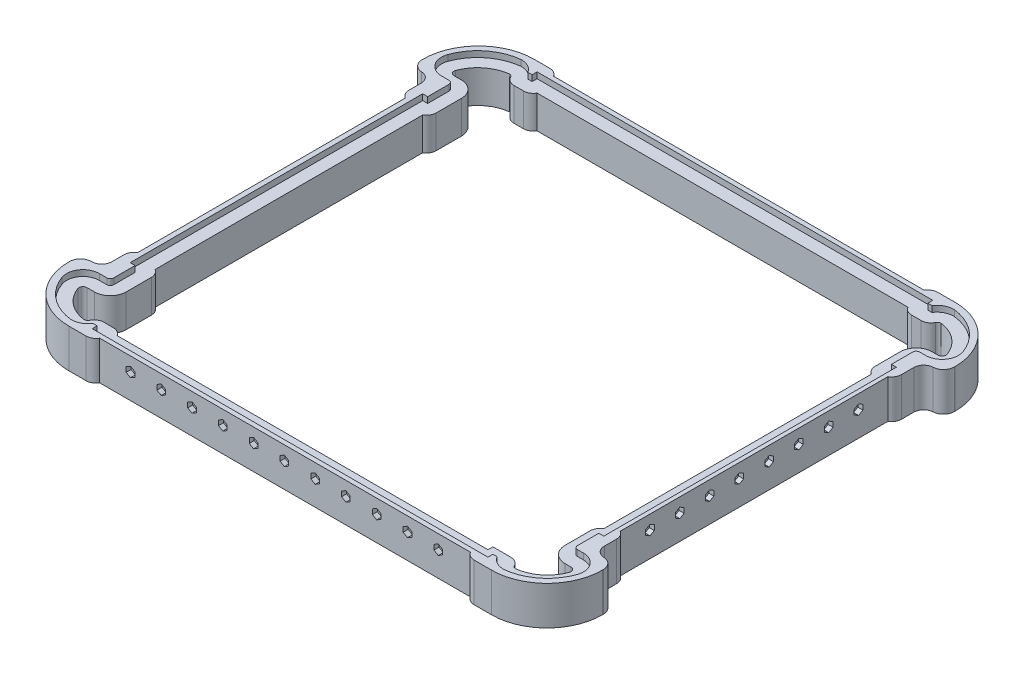
from build123d import *

# Parameters (mm, degrees)
BOSS_EXTRUDE1_DEPTH   = 30
BOSS_EXTRUDE1_2_DEPTH = 30
BOSS_EXTRUDE2_DEPTH   = 3
BOSS_EXTRUDE3_DEPTH   = 6
FILLET1_R             = 10
FILLET2_R             = 10
CUT_EXTRUDE1_DEPTH    = 5
CUT_EXTRUDE2_DEPTH    = 5
CUT_EXTRUDE4_DEPTH    = 5
CUT_EXTRUDE5_DEPTH    = 5


with BuildPart() as part:
    # Sketch1 → Boss-Extrude1 (new body)
    with BuildSketch(Plane(origin=(0, 0, 0), x_dir=(1, 0, 0), z_dir=(0, 1, 0))):
        with BuildLine():
            Line((-239.14494952, -138.470191502), (-244.137311203, -138.454972965))
            Line((-244.137311203, -138.454972965), (-244.184637086, -169.505062385))
            Line((-244.184637086, -169.505062385), (-254.644949535, -169.505062385))
            ThreePointArc((-254.644949535, -169.505062385), (-262.423124128, -172.726887792), (-265.644949535, -180.505062385))
            Line((-265.644949535, -180.505062385), (-265.644949535, -181.194423363))
            ThreePointArc((-265.644949535, -181.194423363), (-249.242929281, -220.792403109), (-209.644949535, -237.194423363))
            Line((-209.644949535, -237.194423363), (-183.644949535, -237.194423363))
            Line((-183.644949535, -237.194423363), (-183.644949535, -232.194423363))
            Line((-183.644949535, -232.194423363), (189.855050465, -232.194423363))
            Line((189.855050465, -232.194423363), (189.855050465, -237.194423363))
            Line((189.855050465, -237.194423363), (215.855050465, -237.194423363))
            ThreePointArc((215.855050465, -237.194423363), (255.408943073, -220.836441217), (271.854911786, -181.319051205))
            Line((271.854911786, -181.319051205), (271.855050146, -180.506936379))
            ThreePointArc((271.855050146, -180.506936379), (268.633887503, -172.727550438), (260.855050465, -169.505062385))
            Line((260.855050465, -169.505062385), (251.894737952, -169.505062385))
            Line((251.894737952, -169.505062385), (251.847412166, -138.454972965))
            Line((251.847412166, -138.454972965), (246.855050467, -138.470191471))
            Line((246.855050467, -138.470191471), (246.855050467, 131.081343169))
            Line((246.855050467, 131.081343169), (251.847411491, 131.066123323))
            Line((251.847411491, 131.066123323), (251.894741453, 162.11621566))
            Line((251.894741453, 162.11621566), (260.855050465, 162.11621566))
            ThreePointArc((260.855050465, 162.11621566), (268.633225058, 165.338041067), (271.855050465, 173.11621566))
            Line((271.855050465, 173.11621566), (271.855050465, 173.805576637))
            ThreePointArc((271.855050465, 173.805576637), (255.453030212, 213.403556384), (215.855050465, 229.805576637))
            Line((215.855050465, 229.805576637), (189.855050465, 229.805576637))
            Line((189.855050465, 229.805576637), (189.855050465, 224.805576637))
            Line((189.855050465, 224.805576637), (-183.644949535, 224.805576637))
            Line((-183.644949535, 224.805576637), (-183.644949535, 229.805576637))
            Line((-183.644949535, 229.805576637), (-208.144949535, 229.805576637))
            ThreePointArc((-208.144949535, 229.805576637), (-247.742929281, 213.403556384), (-264.144949535, 173.805576637))
            Line((-264.144949535, 173.805576637), (-264.144949535, 173.11621566))
            ThreePointArc((-264.144949535, 173.11621566), (-260.923124128, 165.338041067), (-253.144949535, 162.11621566))
            Line((-253.144949535, 162.11621566), (-244.184637078, 162.11621566))
            Line((-244.184637078, 162.11621566), (-244.137311203, 131.066123321))
            Line((-244.137311203, 131.066123321), (-239.14494952, 131.081343138))
            Line((-239.14494952, 131.081343138), (-239.14494952, -138.470191502))
        make_face()
        with BuildLine():
            Line((-188.644949535, 219.805576637), (194.855050465, 219.805576637))
            Line((194.855050465, 219.805576637), (194.855050465, 224.805576637))
            Line((194.855050465, 224.805576637), (215.855050465, 224.805576637))
            ThreePointArc((215.855050465, 224.805576637), (251.917496306, 209.868022478), (266.855050465, 173.805576637))
            Line((266.855050465, 173.805576637), (266.855050465, 173.11621566))
            ThreePointArc((266.855050465, 173.11621566), (265.097691152, 168.873574972), (260.855050465, 167.11621566))
            Line((260.855050465, 167.11621566), (246.902357193, 167.11621566))
            Line((246.902357193, 167.11621566), (246.855050467, 136.081366404))
            Line((246.855050467, 136.081366404), (241.855050467, 136.096609538))
            Line((241.855050467, 136.096609538), (241.855050467, -143.485456493))
            Line((241.855050467, -143.485456493), (246.855050467, -143.470214702))
            Line((246.855050467, -143.470214702), (246.902353022, -174.505062385))
            Line((246.902353022, -174.505062385), (260.855050465, -174.505062385))
            ThreePointArc((260.855050465, -174.505062385), (265.098052491, -176.2627831), (266.855050298, -180.506084527))
            Line((266.855050298, -180.506084527), (266.854912754, -181.312941421))
            ThreePointArc((266.854912754, -181.312941421), (251.875569472, -217.298747349), (215.855050465, -232.194423363))
            Line((215.855050465, -232.194423363), (194.855050465, -232.194423363))
            Line((194.855050465, -232.194423363), (194.855050465, -227.194423363))
            Line((194.855050465, -227.194423363), (-188.644949535, -227.194423363))
            Line((-188.644949535, -227.194423363), (-188.644949535, -232.194423363))
            Line((-188.644949535, -232.194423363), (-209.644949535, -232.194423363))
            ThreePointArc((-209.644949535, -232.194423363), (-245.707395375, -217.256869203), (-260.644949535, -181.194423363))
            Line((-260.644949535, -181.194423363), (-260.644949535, -180.505062385))
            ThreePointArc((-260.644949535, -180.505062385), (-258.887590222, -176.262421698), (-254.644949535, -174.505062385))
            Line((-254.644949535, -174.505062385), (-239.192252171, -174.505062385))
            Line((-239.192252171, -174.505062385), (-239.14494952, -143.470214733))
            Line((-239.14494952, -143.470214733), (-234.14494952, -143.485456555))
            Line((-234.14494952, -143.485456555), (-234.14494952, 136.096609476))
            Line((-234.14494952, 136.096609476), (-239.14494952, 136.081366373))
            Line((-239.14494952, 136.081366373), (-239.192252161, 167.11621566))
            Line((-239.192252161, 167.11621566), (-253.144949535, 167.11621566))
            ThreePointArc((-253.144949535, 167.11621566), (-257.387590222, 168.873574972), (-259.144949535, 173.11621566))
            Line((-259.144949535, 173.11621566), (-259.144949535, 173.805576637))
            ThreePointArc((-259.144949535, 173.805576637), (-244.207395375, 209.868022478), (-208.144949535, 224.805576637))
            Line((-208.144949535, 224.805576637), (-188.644949535, 224.805576637))
            Line((-188.644949535, 224.805576637), (-188.644949535, 219.805576637))
        make_face(mode=Mode.SUBTRACT)
    extrude(amount=BOSS_EXTRUDE1_DEPTH)



with BuildPart() as body_2:
    # Sketch1 → Boss-Extrude1 2 (new body)
    with BuildSketch(Plane(origin=(0, 0, 0), x_dir=(1, 0, 0), z_dir=(0, 1, 0))):
        with BuildLine():
            Line((195.360811946, 212.805576637), (-188.139188054, 212.805576637))
            Line((-188.139188054, 212.805576637), (-188.139188054, 207.805576637))
            Line((-188.139188054, 207.805576637), (-204.96622952, 207.805576637))
            ThreePointArc((-204.96622952, 207.805576637), (-208.071970885, 213.394835809), (-214.105859542, 215.510878151))
            ThreePointArc((-214.105859542, 215.510878151), (-235.212182405, 206.73275334), (-248.595159038, 188.200935393))
            ThreePointArc((-248.595159038, 188.200935393), (-247.51467173, 179.956878373), (-240.140308104, 176.11621566))
            Line((-240.140308104, 176.11621566), (-232.639188044, 176.116215667))
            ThreePointArc((-232.639188044, 176.116215667), (-224.861013445, 172.894390258), (-221.639188036, 165.11621566))
            Line((-221.639188036, 165.11621566), (-221.639188039, 136.081366373))
            Line((-221.639188039, 136.081366373), (-226.639188039, 136.096609476))
            Line((-226.639188039, 136.096609476), (-226.639188039, -143.485456555))
            Line((-226.639188039, -143.485456555), (-221.639188039, -143.470214733))
            Line((-221.639188039, -143.470214733), (-221.639188036, -172.505062385))
            ThreePointArc((-221.639188036, -172.505062385), (-224.861013446, -180.283236983), (-232.639188044, -183.505062392))
            Line((-232.639188044, -183.505062392), (-240.140308104, -183.505062385))
            ThreePointArc((-240.140308104, -183.505062385), (-247.51467173, -187.345725098), (-248.595159038, -195.589782118))
            ThreePointArc((-248.595159038, -195.589782118), (-235.212182405, -214.121600065), (-214.105859542, -222.899724876))
            ThreePointArc((-214.105859542, -222.899724876), (-208.071970885, -220.783682534), (-204.96622952, -215.194423363))
            Line((-204.96622952, -215.194423363), (-188.139188054, -215.194423363))
            Line((-188.139188054, -215.194423363), (-188.139188054, -220.194423363))
            Line((-188.139188054, -220.194423363), (195.360811946, -220.194423363))
            Line((195.360811946, -220.194423363), (195.360811946, -215.194423363))
            Line((195.360811946, -215.194423363), (212.187853412, -215.194423363))
            ThreePointArc((212.187853412, -215.194423363), (215.293594777, -220.783682534), (221.327483434, -222.899724876))
            ThreePointArc((221.327483434, -222.899724876), (242.433806297, -214.121600065), (255.81678293, -195.589782118))
            ThreePointArc((255.81678293, -195.589782118), (254.736295618, -187.345725091), (247.36193198, -183.505062385))
            Line((247.36193198, -183.505062385), (241.360811926, -183.505062402))
            ThreePointArc((241.360811926, -183.505062402), (233.582637321, -180.28323699), (230.360811909, -172.505062385))
            Line((230.360811909, -172.505062385), (230.360811912, -143.470214702))
            Line((230.360811912, -143.470214702), (235.360811912, -143.485456493))
            Line((235.360811912, -143.485456493), (235.360811915, 136.096609538))
            Line((235.360811915, 136.096609538), (230.360811915, 136.081366404))
            Line((230.360811915, 136.081366404), (230.360811912, 165.11621566))
            ThreePointArc((230.360811912, 165.11621566), (233.582637323, 172.894390262), (241.360811926, 176.116215673))
            Line((241.360811926, 176.116215673), (247.361931985, 176.11621566))
            ThreePointArc((247.361931985, 176.11621566), (254.736295619, 179.956878368), (255.81678293, 188.200935393))
            ThreePointArc((255.81678293, 188.200935393), (242.433806297, 206.73275334), (221.327483434, 215.510878151))
            ThreePointArc((221.327483434, 215.510878151), (215.293594777, 213.394835809), (212.187853412, 207.805576637))
            Line((212.187853412, 207.805576637), (195.360811946, 207.805576637))
            Line((195.360811946, 207.805576637), (195.360811946, 212.805576637))
        make_face()
        with BuildLine():
            Line((-232.639188049, 181.116215667), (-240.140308109, 181.11621566))
            ThreePointArc((-240.140308109, 181.11621566), (-243.417803054, 182.823176865), (-243.898019635, 186.487202208))
            ThreePointArc((-243.898019635, 186.487202208), (-232.214437388, 202.728454574), (-213.783841481, 210.512894635))
            ThreePointArc((-213.783841481, 210.512894635), (-209.938380192, 207.233842515), (-212.373583806, 202.805576637))
            Line((-212.373583806, 202.805576637), (-183.139188054, 202.805576637))
            Line((-183.139188054, 202.805576637), (-183.139188054, 207.805576637))
            Line((-183.139188054, 207.805576637), (190.360811946, 207.805576637))
            Line((190.360811946, 207.805576637), (190.360811946, 202.805576637))
            Line((190.360811946, 202.805576637), (219.595207698, 202.805576637))
            ThreePointArc((219.595207698, 202.805576637), (217.160004085, 207.233842515), (221.005465373, 210.512894635))
            ThreePointArc((221.005465373, 210.512894635), (239.436061281, 202.728454574), (251.119643527, 186.487202208))
            ThreePointArc((251.119643527, 186.487202208), (250.639426945, 182.823176863), (247.361931996, 181.11621566))
            Line((247.361931996, 181.11621566), (241.360811926, 181.116215673))
            ThreePointArc((241.360811926, 181.116215673), (230.047103417, 176.429924168), (225.360811912, 165.11621566))
            Line((225.360811912, 165.11621566), (225.360811912, 131.066100035))
            Line((225.360811912, 131.066100035), (230.360811915, 131.081343169))
            Line((230.360811915, 131.081343169), (230.360811915, -138.470191471))
            Line((230.360811915, -138.470191471), (225.360811912, -138.45494968))
            Line((225.360811912, -138.45494968), (225.360811909, -172.505062385))
            ThreePointArc((225.360811909, -172.505062385), (230.04710342, -183.818770901), (241.36081194, -188.505062402))
            Line((241.36081194, -188.505062402), (247.361931994, -188.505062385))
            ThreePointArc((247.361931994, -188.505062385), (250.639426944, -190.212023588), (251.119643527, -193.876048933))
            ThreePointArc((251.119643527, -193.876048933), (239.436061281, -210.1173013), (221.005465373, -217.90174136))
            ThreePointArc((221.005465373, -217.90174136), (217.160004085, -214.62268924), (219.595207698, -210.194423363))
            Line((219.595207698, -210.194423363), (190.360811946, -210.194423363))
            Line((190.360811946, -210.194423363), (190.360811946, -215.194423363))
            Line((190.360811946, -215.194423363), (-183.139188054, -215.194423363))
            Line((-183.139188054, -215.194423363), (-183.139188054, -210.194423363))
            Line((-183.139188054, -210.194423363), (-212.373583806, -210.194423363))
            ThreePointArc((-212.373583806, -210.194423363), (-209.938380192, -214.62268924), (-213.783841481, -217.90174136))
            ThreePointArc((-213.783841481, -217.90174136), (-232.214437388, -210.1173013), (-243.898019635, -193.876048933))
            ThreePointArc((-243.898019635, -193.876048933), (-243.417803054, -190.212023591), (-240.140308109, -188.505062385))
            Line((-240.140308109, -188.505062385), (-232.639188044, -188.505062392))
            ThreePointArc((-232.639188044, -188.505062392), (-221.32547954, -183.818770889), (-216.639188036, -172.505062385))
            Line((-216.639188036, -172.505062385), (-216.639188036, -138.45494968))
            Line((-216.639188036, -138.45494968), (-221.639188039, -138.470191502))
            Line((-221.639188039, -138.470191502), (-221.639188039, 131.081343138))
            Line((-221.639188039, 131.081343138), (-216.639188039, 131.066100035))
            Line((-216.639188039, 131.066100035), (-216.639188036, 165.11621566))
            ThreePointArc((-216.639188036, 165.11621566), (-221.325479541, 176.429924166), (-232.639188049, 181.116215667))
        make_face(mode=Mode.SUBTRACT)
    extrude(amount=BOSS_EXTRUDE1_2_DEPTH)


with BuildPart() as part_1:
    add(part.part)

    add(body_2.part)  # Boss-Extrude2 merges body 2
    # Sketch2 → Boss-Extrude2 (add)
    with BuildSketch(Plane(origin=(0, 30, 0), x_dir=(1, 0, 0), z_dir=(0, 1, 0))):
        with BuildLine():
            Line((-264.144949535, 173.805576637), (-264.144949535, 173.11621566))
            ThreePointArc((-264.144949535, 173.11621566), (-260.923124128, 165.338041067), (-253.144949535, 162.11621566))
            Line((-253.144949535, 162.11621566), (-244.184637078, 162.11621566))
            Line((-244.184637078, 162.11621566), (-244.137311203, 131.066123321))
            Line((-244.137311203, 131.066123321), (-239.14494952, 131.081343138))
            Line((-239.14494952, 131.081343138), (-239.14494952, -138.470191502))
            Line((-239.14494952, -138.470191502), (-244.137311203, -138.454972965))
            Line((-244.137311203, -138.454972965), (-244.184637086, -169.505062385))
            Line((-244.184637086, -169.505062385), (-254.644949535, -169.505062385))
            ThreePointArc((-254.644949535, -169.505062385), (-262.423124128, -172.726887792), (-265.644949535, -180.505062385))
            Line((-265.644949535, -180.505062385), (-265.644949535, -181.194423363))
            ThreePointArc((-265.644949535, -181.194423363), (-249.242929281, -220.792403109), (-209.644949535, -237.194423363))
            Line((-209.644949535, -237.194423363), (-183.644949535, -237.194423363))
            Line((-183.644949535, -237.194423363), (-183.644949535, -232.194423363))
            Line((-183.644949535, -232.194423363), (189.855050465, -232.194423363))
            Line((189.855050465, -232.194423363), (189.855050465, -237.194423363))
            Line((189.855050465, -237.194423363), (215.855050465, -237.194423363))
            ThreePointArc((215.855050465, -237.194423363), (255.408943073, -220.836441217), (271.854911786, -181.319051205))
            Line((271.854911786, -181.319051205), (271.855050146, -180.506936379))
            ThreePointArc((271.855050146, -180.506936379), (268.633887474, -172.72755049), (260.855050465, -169.505062385))
            Line((260.855050465, -169.505062385), (251.894737952, -169.505062385))
            Line((251.894737952, -169.505062385), (251.847412166, -138.454972965))
            Line((251.847412166, -138.454972965), (246.855050467, -138.470191471))
            Line((246.855050467, -138.470191471), (246.855050467, 131.081343169))
            Line((246.855050467, 131.081343169), (251.847411491, 131.066123323))
            Line((251.847411491, 131.066123323), (251.894741453, 162.11621566))
            Line((251.894741453, 162.11621566), (260.855050465, 162.11621566))
            ThreePointArc((260.855050465, 162.11621566), (268.633225058, 165.338041067), (271.855050465, 173.11621566))
            Line((271.855050465, 173.11621566), (271.855050465, 173.805576637))
            ThreePointArc((271.855050465, 173.805576637), (255.453030212, 213.403556384), (215.855050465, 229.805576637))
            Line((215.855050465, 229.805576637), (189.855050465, 229.805576637))
            Line((189.855050465, 229.805576637), (189.855050465, 224.805576637))
            Line((189.855050465, 224.805576637), (-183.644949535, 224.805576637))
            Line((-183.644949535, 224.805576637), (-183.644949535, 229.805576637))
            Line((-183.644949535, 229.805576637), (-208.144949535, 229.805576637))
            ThreePointArc((-208.144949535, 229.805576637), (-247.742929281, 213.403556384), (-264.144949535, 173.805576637))
        make_face()
        with BuildLine():
            Line((-183.139188054, 202.805576637), (-212.373583806, 202.805576637))
            ThreePointArc((-212.373583806, 202.805576637), (-209.938380192, 207.233842515), (-213.783841481, 210.512894635))
            ThreePointArc((-213.783841481, 210.512894635), (-232.214437388, 202.728454574), (-243.898019635, 186.487202208))
            ThreePointArc((-243.898019635, 186.487202208), (-243.417803054, 182.823176865), (-240.140308109, 181.11621566))
            Line((-240.140308109, 181.11621566), (-232.639188054, 181.11621566))
            ThreePointArc((-232.639188054, 181.11621566), (-221.325479555, 176.429924159), (-216.639188054, 165.11621566))
            Line((-216.639188054, 165.11621566), (-216.639188039, 131.066100035))
            Line((-216.639188039, 131.066100035), (-221.639188039, 131.081343138))
            Line((-221.639188039, 131.081343138), (-221.639188039, -138.470191502))
            Line((-221.639188039, -138.470191502), (-216.639188036, -138.45494968))
            Line((-216.639188036, -138.45494968), (-216.639188054, -172.505062385))
            ThreePointArc((-216.639188054, -172.505062385), (-221.325479555, -183.818770884), (-232.639188054, -188.505062385))
            Line((-232.639188054, -188.505062385), (-240.140308109, -188.505062385))
            ThreePointArc((-240.140308109, -188.505062385), (-243.417803054, -190.212023591), (-243.898019635, -193.876048933))
            ThreePointArc((-243.898019635, -193.876048933), (-232.214437388, -210.1173013), (-213.783841481, -217.90174136))
            ThreePointArc((-213.783841481, -217.90174136), (-209.938380192, -214.62268924), (-212.373583806, -210.194423363))
            Line((-212.373583806, -210.194423363), (-183.139188054, -210.194423363))
            Line((-183.139188054, -210.194423363), (-183.139188054, -215.194423363))
            Line((-183.139188054, -215.194423363), (190.360811946, -215.194423363))
            Line((190.360811946, -215.194423363), (190.360811946, -210.194423363))
            Line((190.360811946, -210.194423363), (219.595207698, -210.194423363))
            ThreePointArc((219.595207698, -210.194423363), (217.160004085, -214.62268924), (221.005465373, -217.90174136))
            ThreePointArc((221.005465373, -217.90174136), (239.436061281, -210.1173013), (251.119643527, -193.876048933))
            ThreePointArc((251.119643527, -193.876048933), (250.639426947, -190.212023592), (247.361932005, -188.505062385))
            Line((247.361932005, -188.505062385), (241.360811946, -188.505062385))
            ThreePointArc((241.360811946, -188.505062385), (230.047103447, -183.818770884), (225.360811946, -172.505062385))
            Line((225.360811946, -172.505062385), (225.360811912, -138.45494968))
            Line((225.360811912, -138.45494968), (230.360811915, -138.470191471))
            Line((230.360811915, -138.470191471), (230.360811915, 131.081343169))
            Line((230.360811915, 131.081343169), (225.360811912, 131.066100035))
            Line((225.360811912, 131.066100035), (225.360811946, 165.11621566))
            ThreePointArc((225.360811946, 165.11621566), (230.047103447, 176.429924159), (241.360811946, 181.11621566))
            Line((241.360811946, 181.11621566), (247.361932005, 181.11621566))
            ThreePointArc((247.361932005, 181.11621566), (250.639426947, 182.823176867), (251.119643527, 186.487202208))
            ThreePointArc((251.119643527, 186.487202208), (239.436061281, 202.728454574), (221.005465373, 210.512894635))
            ThreePointArc((221.005465373, 210.512894635), (217.160004085, 207.233842515), (219.595207698, 202.805576637))
            Line((219.595207698, 202.805576637), (190.360811946, 202.805576637))
            Line((190.360811946, 202.805576637), (190.360811946, 207.805576637))
            Line((190.360811946, 207.805576637), (-183.139188054, 207.805576637))
            Line((-183.139188054, 207.805576637), (-183.139188054, 202.805576637))
        make_face(mode=Mode.SUBTRACT)
    extrude(amount=BOSS_EXTRUDE2_DEPTH)

    # Sketch6 → Boss-Extrude3 (add)
    with BuildSketch(Plane(origin=(0, 33, 0), x_dir=(1, 0, 0), z_dir=(0, 1, 0))):
        with BuildLine():
            Line((-264.144949535, 173.805576637), (-264.144949535, 173.11621566))
            ThreePointArc((-264.144949535, 173.11621566), (-260.923124128, 165.338041067), (-253.144949535, 162.11621566))
            Line((-253.144949535, 162.11621566), (-244.184637078, 162.11621566))
            Line((-244.184637078, 162.11621566), (-244.137311203, 131.066123321))
            Line((-244.137311203, 131.066123321), (-239.14494952, 131.081343138))
            Line((-239.14494952, 131.081343138), (-239.14494952, -138.470191502))
            Line((-239.14494952, -138.470191502), (-244.137311203, -138.454972965))
            Line((-244.137311203, -138.454972965), (-244.184637086, -169.505062385))
            Line((-244.184637086, -169.505062385), (-254.644949535, -169.505062385))
            ThreePointArc((-254.644949535, -169.505062385), (-262.423124128, -172.726887792), (-265.644949535, -180.505062385))
            Line((-265.644949535, -180.505062385), (-265.644949535, -181.194423363))
            ThreePointArc((-265.644949535, -181.194423363), (-249.242929281, -220.792403109), (-209.644949535, -237.194423363))
            Line((-209.644949535, -237.194423363), (-183.644949535, -237.194423363))
            Line((-183.644949535, -237.194423363), (-183.644949535, -232.194423363))
            Line((-183.644949535, -232.194423363), (189.855050465, -232.194423363))
            Line((189.855050465, -232.194423363), (189.855050465, -237.194423363))
            Line((189.855050465, -237.194423363), (215.855050465, -237.194423363))
            ThreePointArc((215.855050465, -237.194423363), (255.408943073, -220.836441217), (271.854911786, -181.319051205))
            Line((271.854911786, -181.319051205), (271.855050146, -180.506936379))
            ThreePointArc((271.855050146, -180.506936379), (268.633887474, -172.72755049), (260.855050465, -169.505062385))
            Line((260.855050465, -169.505062385), (251.894737952, -169.505062385))
            Line((251.894737952, -169.505062385), (251.847412166, -138.454972965))
            Line((251.847412166, -138.454972965), (246.855050467, -138.470191471))
            Line((246.855050467, -138.470191471), (246.855050467, 131.081343169))
            Line((246.855050467, 131.081343169), (251.847411491, 131.066123323))
            Line((251.847411491, 131.066123323), (251.894741453, 162.11621566))
            Line((251.894741453, 162.11621566), (260.855050465, 162.11621566))
            ThreePointArc((260.855050465, 162.11621566), (268.633225058, 165.338041067), (271.855050465, 173.11621566))
            Line((271.855050465, 173.11621566), (271.855050465, 173.805576637))
            ThreePointArc((271.855050465, 173.805576637), (255.453030212, 213.403556384), (215.855050465, 229.805576637))
            Line((215.855050465, 229.805576637), (189.855050465, 229.805576637))
            Line((189.855050465, 229.805576637), (189.855050465, 224.805576637))
            Line((189.855050465, 224.805576637), (-183.644949535, 224.805576637))
            Line((-183.644949535, 224.805576637), (-183.644949535, 229.805576637))
            Line((-183.644949535, 229.805576637), (-208.144949535, 229.805576637))
            ThreePointArc((-208.144949535, 229.805576637), (-247.742929281, 213.403556384), (-264.144949535, 173.805576637))
        make_face()
        with BuildLine():
            Line((-195.639188054, 215.305576637), (-199.910382166, 215.305576637))
            ThreePointArc((-199.910382166, 215.305576637), (-206.256628369, 221.150830632), (-214.685448656, 222.993878024))
            ThreePointArc((-214.685448656, 222.993878024), (-239.746652459, 212.708444433), (-255.640868142, 190.771535171))
            ThreePointArc((-255.640868142, 190.771535171), (-253.659974745, 175.657430634), (-240.140308096, 168.61621566))
            Line((-240.140308096, 168.61621566), (-232.639188054, 168.61621566))
            ThreePointArc((-232.639188054, 168.61621566), (-230.16431432, 167.591089394), (-229.139188054, 165.11621566))
            Line((-229.139188054, 165.11621566), (-229.139188044, 143.60426588))
            Line((-229.139188044, 143.60426588), (-234.139188039, 143.619508983))
            Line((-234.139188039, 143.619508983), (-234.139188039, -151.008354134))
            Line((-234.139188039, -151.008354134), (-229.139188043, -150.993112312))
            Line((-229.139188043, -150.993112312), (-229.139188054, -172.505062385))
            ThreePointArc((-229.139188054, -172.505062385), (-230.16431432, -174.979936119), (-232.639188054, -176.005062385))
            Line((-232.639188054, -176.005062385), (-240.140308109, -176.005062385))
            ThreePointArc((-240.140308109, -176.005062385), (-253.659974748, -183.046277364), (-255.640868142, -198.160381896))
            ThreePointArc((-255.640868142, -198.160381896), (-239.746652459, -220.097291158), (-214.685448656, -230.38272475))
            ThreePointArc((-214.685448656, -230.38272475), (-206.256628369, -228.539677358), (-199.910382166, -222.694423363))
            Line((-199.910382166, -222.694423363), (-195.639188054, -222.694423363))
            Line((-195.639188054, -222.694423363), (-195.639188054, -227.694423363))
            Line((-195.639188054, -227.694423363), (202.860811946, -227.694423363))
            Line((202.860811946, -227.694423363), (202.860811946, -222.694423363))
            Line((202.860811946, -222.694423363), (207.132006059, -222.694423363))
            ThreePointArc((207.132006059, -222.694423363), (213.478252261, -228.539677358), (221.907072549, -230.38272475))
            ThreePointArc((221.907072549, -230.38272475), (246.968276351, -220.097291158), (262.862492035, -198.160381896))
            ThreePointArc((262.862492035, -198.160381896), (260.881598642, -183.046277366), (247.361932005, -176.005062385))
            Line((247.361932005, -176.005062385), (241.360811946, -176.005062385))
            ThreePointArc((241.360811946, -176.005062385), (238.885938212, -174.979936119), (237.860811946, -172.505062385))
            Line((237.860811946, -172.505062385), (237.860811925, -150.993112235))
            Line((237.860811925, -150.993112235), (242.860811915, -151.008354025))
            Line((242.860811915, -151.008354025), (242.860811915, 143.619509092))
            Line((242.860811915, 143.619509092), (237.860811925, 143.604265958))
            Line((237.860811925, 143.604265958), (237.860811946, 165.11621566))
            ThreePointArc((237.860811946, 165.11621566), (238.885938212, 167.591089394), (241.360811946, 168.61621566))
            Line((241.360811946, 168.61621566), (247.361932005, 168.61621566))
            ThreePointArc((247.361932005, 168.61621566), (260.881598642, 175.657430641), (262.862492035, 190.771535171))
            ThreePointArc((262.862492035, 190.771535171), (246.968276351, 212.708444433), (221.907072549, 222.993878024))
            ThreePointArc((221.907072549, 222.993878024), (213.478252261, 221.150830632), (207.132006059, 215.305576637))
            Line((207.132006059, 215.305576637), (202.860811946, 215.305576637))
            Line((202.860811946, 215.305576637), (202.860811946, 220.305576637))
            Line((202.860811946, 220.305576637), (-195.639188054, 220.305576637))
            Line((-195.639188054, 220.305576637), (-195.639188054, 215.305576637))
        make_face(mode=Mode.SUBTRACT)
    extrude(amount=BOSS_EXTRUDE3_DEPTH)

    # Fillet1
    # the kernel refuses this fillet: 10 mm, written as the material it adds along each edge
    with BuildSketch(Plane(origin=(251.894741453, 0, -162.11621566), x_dir=(0.9999990489347282, 1.4575221743334974e-15, -0.001379177160168719), z_dir=(0, 1, 0))) as fillet1_piece_1:
        with BuildLine():
            CenterArc((9.971039854, -9.988756077), FILLET1_R, 92.717297958, 87.116344533)
            Line((-0.028917995, -9.959721255), (-1.02891378, -9.956817773))
            Line((-1.02891378, -9.956817773), (-0.999995785, 0.002903482))
            Line((-0.999995785, 0.002903482), (0.001379177, 0.999999049))
            ThreePointArc((0.001379177, 0.999999049), (8.961679668, 0.987641195), (9.449551637, 0.998875608))
            Line((9.449551637, 0.998875608), (9.496959656, 0))
        make_face()
    extrude(amount=39)
    with BuildSketch(Plane(origin=(251.894737952, 0, 169.505062385), x_dir=(-0.0015241737414147373, 0, -0.9999988384465285), z_dir=(0, 1, 0))) as fillet1_piece_2:
        with BuildLine():
            CenterArc((9.959764677, -10), FILLET1_R, 90, 87.116357764)
            Line((-0.027572929, -9.496921932), (-1.02630669, -9.446614125))
            ThreePointArc((-1.02630669, -9.446614125), (-1.013655911, -8.95877792), (-0.999998838, 0.001524174))
            Line((-0.999998838, 0.001524174), (0, 1))
            Line((0, 1), (9.959764677, 1))
            Line((9.959764677, 1), (9.959764677, 0))
        make_face()
    extrude(amount=30.000000101)
    with BuildSketch(Plane(origin=(251.894737952, 30.000000101, 169.505062385), x_dir=(-0.0015241737414154498, 0, -0.9999988384465285), z_dir=(0, 1, 0))) as fillet1_piece_3:
        with BuildLine():
            CenterArc((9.959764671, -10), FILLET1_R, 90, 87.116357409)
            Line((-0.027572932, -9.49692187), (-1.026306693, -9.446614057))
            ThreePointArc((-1.026306693, -9.446614057), (-1.013655911, -8.958777907), (-0.999998838, 0.001524174))
            Line((-0.999998838, 0.001524174), (0, 1))
            Line((0, 1), (9.959764671, 1))
            Line((9.959764671, 1), (9.959764671, 0))
        make_face()
    extrude(amount=8.999999899)
    with BuildSketch(Plane(origin=(-244.184637086, 0, 169.505062385), x_dir=(-1, 0, 0), z_dir=(0, 1, 0))) as fillet1_piece_4:
        with BuildLine():
            CenterArc((FILLET1_R * 0.998476982945, -FILLET1_R), FILLET1_R, 90, 89.912671066)
            Line((-FILLET1_R * 0.0015218554969, -FILLET1_R * 0.998475823156), (0, 0))
            Line((0, 0), (FILLET1_R * 0.998476982945, 0))
        make_face()
    extrude(amount=39)
    with BuildSketch(Plane(origin=(-244.184637078, 0, -162.11621566), x_dir=(0.0015241764536381252, 0, 0.9999988384423946), z_dir=(0, 1, 0))) as fillet1_piece_5:
        with BuildLine():
            CenterArc((9.959764655, -10), FILLET1_R, 90, 87.116357902)
            Line((-0.027572952, -9.496921956), (-1.026306713, -9.446614152))
            ThreePointArc((-1.026306713, -9.446614152), (-1.013655936, -8.958777872), (-0.999998838, 0.001524176))
            Line((-0.999998838, 0.001524176), (0, 1))
            Line((0, 1), (9.959764655, 1))
            Line((9.959764655, 1), (9.959764655, 0))
        make_face()
    extrude(amount=39)
    # the kernel refuses this fillet: 10 mm, written as the material it takes off along each edge
    with BuildSketch(Plane(origin=(-183.139188054, -21.650635095, 210.194423363), x_dir=(-1, 0, 0), z_dir=(0, 1, 0)), Plane(origin=(190.360811946, -21.650635095, -202.805576637), x_dir=(1, 0, 0), z_dir=(0, 1, 0))) as fillet1_2_piece_1:
        with BuildLine():
            CenterArc((8.660254038, 10), FILLET1_R, 210, 60)
            Line((0, 5), (0, 0))
            Line((0, 0), (8.660254038, 0))
        make_face()
    extrude(amount=76.301270189, mode=Mode.SUBTRACT)
    with BuildSketch(Plane(origin=(-216.639188036, -21.688739659, 138.45494968), x_dir=(-0.9999953537698948, 0, 0.003048350147705137), z_dir=(0, 1, 0))) as fillet1_2_piece_2:
        with BuildLine():
            CenterArc((10.026399491, 8.644972049), FILLET1_R, 179.825342102, 60.000000017)
            Line((0.026445954, 8.675455555), (0, 0))
            Line((0, 0), (5.000023234, 0))
        make_face()
    extrude(amount=76.377479317, mode=Mode.SUBTRACT)
    with BuildSketch(Plane(origin=(-216.639188039, 54.688742857, -131.066100035), x_dir=(-4.339705378708664e-10, 0, -1.0), z_dir=(0, -1, 0))) as fillet1_2_piece_3:
        with BuildLine():
            CenterArc((8.675497143, -10), FILLET1_R, 90, 60)
            Line((0.015243105, -5), (0, 0))
            Line((0, 0), (8.675497143, 0))
        make_face()
    extrude(amount=76.377485715, mode=Mode.SUBTRACT)
    with BuildSketch(Plane(origin=(-183.139188054, -21.650635095, -202.805576637), x_dir=(0, 0, -1), z_dir=(0, 1, 0))) as fillet1_2_piece_4:
        with BuildLine():
            CenterArc((10, 8.660254038), FILLET1_R, 180, 60)
            Line((0, 8.660254038), (0, 0))
            Line((0, 0), (5, 0))
        make_face()
    extrude(amount=76.301270189, mode=Mode.SUBTRACT)
    with BuildSketch(Plane(origin=(225.360811912, -21.688739588, 138.45494968), x_dir=(1.0071259111979966e-09, 0, 1.0), z_dir=(0, 1, 0))) as fillet1_2_piece_5:
        with BuildLine():
            CenterArc((8.675495835, 10), FILLET1_R, 209.999999981, 60.000000019)
            Line((0.015241796, 5.000000003), (0, 0))
            Line((0, 0), (8.675495835, 0))
        make_face()
    extrude(amount=76.377479175, mode=Mode.SUBTRACT)
    with BuildSketch(Plane(origin=(225.360811912, 54.688742946, -131.066100035), x_dir=(0.9999953529697613, 0, -0.003048612616060605), z_dir=(0, -1, 0))) as fillet1_2_piece_6:
        with BuildLine():
            CenterArc((10.026401768, -8.644970727), FILLET1_R, 120.174672947, 60.000000017)
            Line((0.026448239, -8.675456863), (0, 0))
            Line((0, 0), (5.000023238, 0))
        make_face()
    extrude(amount=76.377485891, mode=Mode.SUBTRACT)
    with BuildSketch(Plane(origin=(251.847411491, -21.658647942, -131.066123323), x_dir=(0.0015243080788717575, 0, -0.9999988382417655), z_dir=(0, 1, 0))) as fillet1_2_piece_7:
        with BuildLine():
            CenterArc((8.663459177, 10), FILLET1_R, 210.050436763, 59.949563237)
            Line((0.007609932, 4.992378424), (0, 0))
            Line((0, 0), (8.663459177, 0))
        make_face()
    extrude(amount=82.317295883, mode=Mode.SUBTRACT)
    with BuildSketch(Plane(origin=(251.847412166, -21.658647239, 138.454972965), x_dir=(-0.9999953537888119, 0, 0.0030483439420749296), z_dir=(0, 1, 0))) as fillet1_2_piece_8:
        with BuildLine():
            CenterArc((10.013193001, 8.648207095), FILLET1_R, 179.912671244, 59.949567683)
            Line((0.013204617, 8.663448833), (0, 0))
            Line((0, 0), (4.992384895, 0))
        make_face()
    extrude(amount=82.317294478, mode=Mode.SUBTRACT)
    with BuildSketch(Plane(origin=(-183.644949535, -21.650635095, 237.194423363), x_dir=(0, 0, -1), z_dir=(0, 1, 0)), Plane(origin=(189.855050465, -21.650635095, -229.805576637), x_dir=(0, 0, 1), z_dir=(0, 1, 0)), Plane(origin=(-183.644949535, 60.650635095, -229.805576637), x_dir=(0, 0, 1), z_dir=(0, -1, 0))) as fillet1_2_piece_9:
        with BuildLine():
            CenterArc((10, 8.660254038), FILLET1_R, 180, 60)
            Line((0, 8.660254038), (0, 0))
            Line((0, 0), (5, 0))
        make_face()
    extrude(amount=82.301270189, mode=Mode.SUBTRACT)
    with BuildSketch(Plane(origin=(189.855050465, -21.650635095, 237.194423363), x_dir=(1, 0, 0), z_dir=(0, 1, 0))) as fillet1_2_piece_10:
        with BuildLine():
            CenterArc((8.660254038, 10), FILLET1_R, 210, 60)
            Line((0, 5), (0, 0))
            Line((0, 0), (8.660254038, 0))
        make_face()
    extrude(amount=82.301270189, mode=Mode.SUBTRACT)
    with BuildSketch(Plane(origin=(-244.137311203, -21.658647255, 138.454972965), x_dir=(-0.001524176844238222, 0, 0.9999988384417992), z_dir=(0, 1, 0))) as fillet1_2_piece_11:
        with BuildLine():
            CenterArc((8.663458902, 10), FILLET1_R, 210.05043242, 59.94956758)
            Line((0.007609277, 4.99237908), (0, 0))
            Line((0, 0), (8.663458902, 0))
        make_face()
    extrude(amount=82.317294511, mode=Mode.SUBTRACT)
    with BuildSketch(Plane(origin=(-244.137311203, -21.658650461, -131.066123321), x_dir=(0.999995352988669, 0, -0.003048606413924148), z_dir=(0, 1, 0))) as fillet1_2_piece_12:
        with BuildLine():
            CenterArc((10.013195249, 8.648205783), FILLET1_R, 179.91265636, 59.949567593)
            Line((0.013206869, 8.663450118), (0, 0))
            Line((0, 0), (4.992384883, 0))
        make_face()
    extrude(amount=82.317300923, mode=Mode.SUBTRACT)

    # Fillet2
    fillet2_edges = [part_1.edges().sort_by_distance(p)[0] for p in [
        (-212.373583806, 16.5, 210.194423363),
        (219.595207698, 16.5, 210.194423363),
        (219.595207698, 16.5, -202.805576637),
        (-212.373583806, 16.5, -202.805576637),
    ]]
    fillet(fillet2_edges, radius=FILLET2_R)

    # Sketch8 → Cut-Extrude1 (cut)
    with BuildSketch(Plane(origin=(246.855050467, 0, 0), x_dir=(0, 0, -1), z_dir=(1, 0, 0))):
        Polygon((-78.470191471, 30), (-82.80031849, 27.5), (-82.80031849, 22.5), (-78.470191471, 20), (-74.140064452, 22.5), (-74.140064452, 27.5), align=None)
        Polygon((-108.470191471, 30), (-112.80031849, 27.5), (-112.80031849, 22.5), (-108.470191471, 20), (-104.140064452, 22.5), (-104.140064452, 27.5), align=None)
        Polygon((-48.470191471, 30), (-52.80031849, 27.5), (-52.80031849, 22.5), (-48.470191471, 20), (-44.140064452, 22.5), (-44.140064452, 27.5), align=None)
        Polygon((-18.470191471, 30), (-22.80031849, 27.5), (-22.80031849, 22.5), (-18.470191471, 20), (-14.140064452, 22.5), (-14.140064452, 27.5), align=None)
        Polygon((11.529808529, 30), (7.19968151, 27.5), (7.19968151, 22.5), (11.529808529, 20), (15.859935548, 22.5), (15.859935548, 27.5), align=None)
        Polygon((41.529808529, 30), (37.19968151, 27.5), (37.19968151, 22.5), (41.529808529, 20), (45.859935548, 22.5), (45.859935548, 27.5), align=None)
        Polygon((71.529808529, 30), (67.19968151, 27.5), (67.19968151, 22.5), (71.529808529, 20), (75.859935548, 22.5), (75.859935548, 27.5), align=None)
        Polygon((101.529808529, 30), (97.19968151, 27.5), (97.19968151, 22.5), (101.529808529, 20), (105.859935548, 22.5), (105.859935548, 27.5), align=None)
    extrude(amount=-CUT_EXTRUDE1_DEPTH, mode=Mode.SUBTRACT)

    # Sketch9 → Cut-Extrude2 (cut)
    with BuildSketch(Plane.ZY.offset(239.14494952)):
        Polygon((-71.081343138, 30), (-75.411470157, 27.5), (-75.411470157, 22.5), (-71.081343138, 20), (-66.751216119, 22.5), (-66.751216119, 27.5), align=None)
        Polygon((-101.081343138, 30), (-105.411470157, 27.5), (-105.411470157, 22.5), (-101.081343138, 20), (-96.751216119, 22.5), (-96.751216119, 27.5), align=None)
        Polygon((-41.081343138, 30), (-45.411470157, 27.5), (-45.411470157, 22.5), (-41.081343138, 20), (-36.751216119, 22.5), (-36.751216119, 27.5), align=None)
        Polygon((-11.081343138, 30), (-15.411470157, 27.5), (-15.411470157, 22.5), (-11.081343138, 20), (-6.751216119, 22.5), (-6.751216119, 27.5), align=None)
        Polygon((18.918656862, 30), (14.588529843, 27.5), (14.588529843, 22.5), (18.918656862, 20), (23.248783881, 22.5), (23.248783881, 27.5), align=None)
        Polygon((48.918656862, 30), (44.588529843, 27.5), (44.588529843, 22.5), (48.918656862, 20), (53.248783881, 22.5), (53.248783881, 27.5), align=None)
        Polygon((78.918656862, 30), (74.588529843, 27.5), (74.588529843, 22.5), (78.918656862, 20), (83.248783881, 22.5), (83.248783881, 27.5), align=None)
        Polygon((108.918656862, 30), (104.588529843, 27.5), (104.588529843, 22.5), (108.918656862, 20), (113.248783881, 22.5), (113.248783881, 27.5), align=None)
    extrude(amount=-CUT_EXTRUDE2_DEPTH, mode=Mode.SUBTRACT)

    # Sketch10 → Cut-Extrude4 (cut)
    with BuildSketch(Plane(origin=(0, 0, -224.805576637), x_dir=(-1, 0, 0), z_dir=(0, 0, -1))):
        Polygon((-127.855050465, 30), (-132.185177484, 27.5), (-132.185177484, 22.5), (-127.855050465, 20), (-123.524923446, 22.5), (-123.524923446, 27.5), align=None)
        Polygon((-158.855050465, 30), (-163.185177484, 27.5), (-163.185177484, 22.5), (-158.855050465, 20), (-154.524923446, 22.5), (-154.524923446, 27.5), align=None)
        Polygon((-96.855050465, 30), (-101.185177484, 27.5), (-101.185177484, 22.5), (-96.855050465, 20), (-92.524923446, 22.5), (-92.524923446, 27.5), align=None)
        Polygon((-65.855050465, 30), (-70.185177484, 27.5), (-70.185177484, 22.5), (-65.855050465, 20), (-61.524923446, 22.5), (-61.524923446, 27.5), align=None)
        Polygon((-34.855050465, 30), (-39.185177484, 27.5), (-39.185177484, 22.5), (-34.855050465, 20), (-30.524923446, 22.5), (-30.524923446, 27.5), align=None)
        Polygon((-3.855050465, 30), (-8.185177484, 27.5), (-8.185177484, 22.5), (-3.855050465, 20), (0.475076554, 22.5), (0.475076554, 27.5), align=None)
        Polygon((27.144949535, 30), (22.814822516, 27.5), (22.814822516, 22.5), (27.144949535, 20), (31.475076554, 22.5), (31.475076554, 27.5), align=None)
        Polygon((58.144949535, 30), (53.814822516, 27.5), (53.814822516, 22.5), (58.144949535, 20), (62.475076554, 22.5), (62.475076554, 27.5), align=None)
        Polygon((89.144949535, 30), (84.814822516, 27.5), (84.814822516, 22.5), (89.144949535, 20), (93.475076554, 22.5), (93.475076554, 27.5), align=None)
        Polygon((120.144949535, 30), (115.814822516, 27.5), (115.814822516, 22.5), (120.144949535, 20), (124.475076554, 22.5), (124.475076554, 27.5), align=None)
        Polygon((151.144949535, 30), (146.814822516, 27.5), (146.814822516, 22.5), (151.144949535, 20), (155.475076554, 22.5), (155.475076554, 27.5), align=None)
    extrude(amount=-CUT_EXTRUDE4_DEPTH, mode=Mode.SUBTRACT)

    # Sketch11 → Cut-Extrude5 (cut)
    with BuildSketch(Plane.XY.offset(232.194423363)):
        Polygon((-121.644949535, 30), (-125.975076554, 27.5), (-125.975076554, 22.5), (-121.644949535, 20), (-117.314822516, 22.5), (-117.314822516, 27.5), align=None)
        Polygon((-152.644949535, 30), (-156.975076554, 27.5), (-156.975076554, 22.5), (-152.644949535, 20), (-148.314822516, 22.5), (-148.314822516, 27.5), align=None)
        Polygon((-90.644949535, 30), (-94.975076554, 27.5), (-94.975076554, 22.5), (-90.644949535, 20), (-86.314822516, 22.5), (-86.314822516, 27.5), align=None)
        Polygon((-59.644949535, 30), (-63.975076554, 27.5), (-63.975076554, 22.5), (-59.644949535, 20), (-55.314822516, 22.5), (-55.314822516, 27.5), align=None)
        Polygon((-28.644949535, 30), (-32.975076554, 27.5), (-32.975076554, 22.5), (-28.644949535, 20), (-24.314822516, 22.5), (-24.314822516, 27.5), align=None)
        Polygon((2.355050465, 30), (-1.975076554, 27.5), (-1.975076554, 22.5), (2.355050465, 20), (6.685177484, 22.5), (6.685177484, 27.5), align=None)
        Polygon((33.355050465, 30), (29.024923446, 27.5), (29.024923446, 22.5), (33.355050465, 20), (37.685177484, 22.5), (37.685177484, 27.5), align=None)
        Polygon((64.355050465, 30), (60.024923446, 27.5), (60.024923446, 22.5), (64.355050465, 20), (68.685177484, 22.5), (68.685177484, 27.5), align=None)
        Polygon((95.355050465, 30), (91.024923446, 27.5), (91.024923446, 22.5), (95.355050465, 20), (99.685177484, 22.5), (99.685177484, 27.5), align=None)
        Polygon((126.355050465, 30), (122.024923446, 27.5), (122.024923446, 22.5), (126.355050465, 20), (130.685177484, 22.5), (130.685177484, 27.5), align=None)
        Polygon((157.355050465, 30), (153.024923446, 27.5), (153.024923446, 22.5), (157.355050465, 20), (161.685177484, 22.5), (161.685177484, 27.5), align=None)
    extrude(amount=-CUT_EXTRUDE5_DEPTH, mode=Mode.SUBTRACT)


solid = part_1.part
